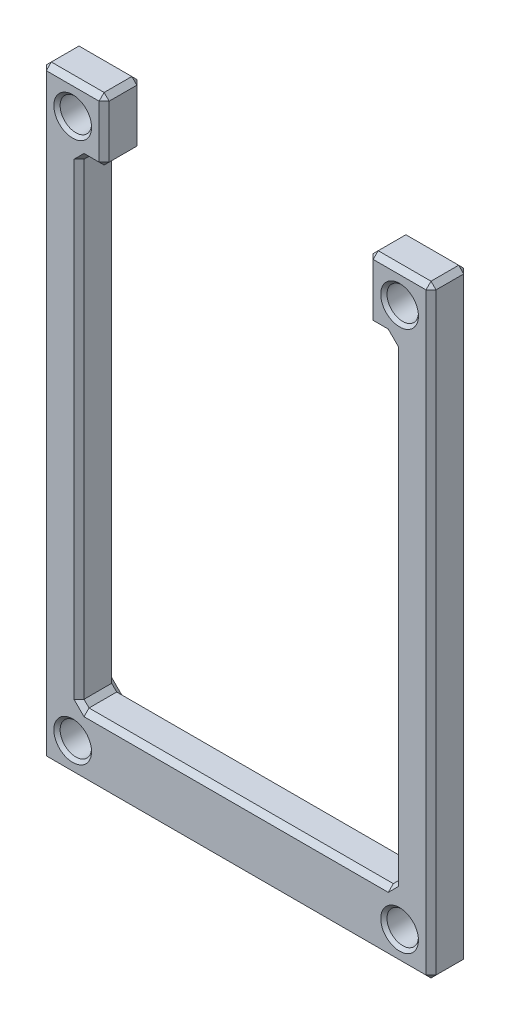
from build123d import *

# Parameters (mm, degrees)
AUFSATZ_LINEAR_AUSTRAGEN1_DEPTH           = 1.5
F_2_5_2_5_DURCHMESSER_BOHRUNG1_AT_2_COUNT = 2
F_2_5_2_5_DURCHMESSER_BOHRUNG1_AT_2_PITCH = 25.124689053
F_2_5_2_5_DURCHMESSER_BOHRUNG1_AT_3_COUNT = 2
F_2_5_2_5_DURCHMESSER_BOHRUNG1_AT_3_PITCH = 25.124689053
F_2_5_2_5_DURCHMESSER_BOHRUNG1_AT_4_COUNT = 2
F_2_5_2_5_DURCHMESSER_BOHRUNG1_AT_4_PITCH = 25.124689053
F_2_5_2_5_DURCHMESSER_BOHRUNG1_AT_5_COUNT = 2
F_2_5_2_5_DURCHMESSER_BOHRUNG1_AT_5_PITCH = 25.124689053
SKIZZE4_W                                 = 25
SKIZZE4_H                                 = 38
SCHNITT_LINEAR_AUSTRAGEN1_DEPTH           = 3
FASE1_SIZE                                = 0.4


with BuildPart() as part:
    # Skizze1 → Aufsatz-Linear austragen1 (new, symmetric)
    with BuildSketch(Plane(origin=(0, 0, 0), x_dir=(0, 1, 0), z_dir=(0, 0, 1))):
        Polygon((-24, 15.5), (24, 15.5), (24, 10.5), (-19, 10.5), (-19, -10.5), (24, -10.5), (24, -15.5), (-24, -15.5), align=None)
    extrude(amount=AUFSATZ_LINEAR_AUSTRAGEN1_DEPTH, both=True)

    # Skizze3 → Ø2.5 (2.5) Durchmesser Bohrung1 (revolve, cut)
    with BuildSketch(Plane(origin=(0, 0, 1.5), x_dir=(0, -1, 0), z_dir=(1, 0, 0))):
        Polygon((0, 0), (0, 3), (1.5, 3), (1.25, 2.75), (1.25, 0.25), (1.5, 0), align=None)
    f_2_5_2_5_durchmesser_bohrung1 = revolve(axis=Axis((0, 0, 7.85), (0, 0, -1)), mode=Mode.SUBTRACT)

    # Ø2.5 (2.5) Durchmesser Bohrung1 at 2: Ø2.5 (2.5) Durchmesser Bohrung1 ×2
    with Locations(*[Vector(0.5174193389091943, 0.8557319835805908, 0) * (i * F_2_5_2_5_DURCHMESSER_BOHRUNG1_AT_2_PITCH) for i in range(1, F_2_5_2_5_DURCHMESSER_BOHRUNG1_AT_2_COUNT)]):
        add(f_2_5_2_5_durchmesser_bohrung1, mode=Mode.SUBTRACT)

    # Ø2.5 (2.5) Durchmesser Bohrung1 at 3: Ø2.5 (2.5) Durchmesser Bohrung1 ×2
    with Locations(*[Vector(-0.5174193389091943, -0.8557319835805908, 0) * (i * F_2_5_2_5_DURCHMESSER_BOHRUNG1_AT_3_PITCH) for i in range(1, F_2_5_2_5_DURCHMESSER_BOHRUNG1_AT_3_COUNT)]):
        add(f_2_5_2_5_durchmesser_bohrung1, mode=Mode.SUBTRACT)

    # Ø2.5 (2.5) Durchmesser Bohrung1 at 4: Ø2.5 (2.5) Durchmesser Bohrung1 ×2
    with Locations(*[Vector(0.5174193389091946, -0.8557319835805907, 0) * (i * F_2_5_2_5_DURCHMESSER_BOHRUNG1_AT_4_PITCH) for i in range(1, F_2_5_2_5_DURCHMESSER_BOHRUNG1_AT_4_COUNT)]):
        add(f_2_5_2_5_durchmesser_bohrung1, mode=Mode.SUBTRACT)

    # Ø2.5 (2.5) Durchmesser Bohrung1 at 5: Ø2.5 (2.5) Durchmesser Bohrung1 ×2
    with Locations(*[Vector(-0.5174193389091944, 0.8557319835805907, 0) * (i * F_2_5_2_5_DURCHMESSER_BOHRUNG1_AT_5_PITCH) for i in range(1, F_2_5_2_5_DURCHMESSER_BOHRUNG1_AT_5_COUNT)]):
        add(f_2_5_2_5_durchmesser_bohrung1, mode=Mode.SUBTRACT)

    # Skizze4 → Schnitt-Linear austragen1 (cut)
    with BuildSketch(Plane.XY.offset(1.5)):
        Rectangle(SKIZZE4_W, SKIZZE4_H)
    extrude(amount=-SCHNITT_LINEAR_AUSTRAGEN1_DEPTH, mode=Mode.SUBTRACT)

    # Fase1
    fase1_edges = [part.edges().sort_by_distance(p)[0] for p in [
        (10.5, 21.5, -1.5),
        (13, 24, -1.5),
        (15.5, 0, -1.5),
        (0, -24, -1.5),
        (13, 24, 1.5),
        (-15.5, -24, 0),
        (-15.5, 24, 0),
        (-10.5, 24, 0),
        (10.5, 24, 0),
        (15.5, 24, 0),
        (15.5, -24, 0),
        (10.5, 21.5, 1.5),
        (0, -19, 1.5),
        (-13, 24, 1.5),
        (-15.5, 0, 1.5),
        (0, -24, 1.5),
        (-10.5, 21.5, -1.5),
        (-11.5, 19, -1.5),
        (-10.5, 21.5, 1.5),
        (11.5, 19, 1.5),
        (12.5, 0, 1.5),
        (-11.5, 19, 1.5),
        (-12.5, 0, 1.5),
        (12.5, -19, 0),
        (11.5, 19, -1.5),
        (10.5, 19, 0),
        (-10.5, 19, 0),
        (-12.5, 19, 0),
        (12.5, 0, -1.5),
        (12.5, 19, 0),
        (-12.5, 0, -1.5),
        (-12.5, -19, 0),
        (-15.5, 0, -1.5),
        (15.5, 0, 1.5),
        (-13, 24, -1.5),
        (0, -19, -1.5),
    ]]
    chamfer(fase1_edges, length=FASE1_SIZE)


solid = part.part
